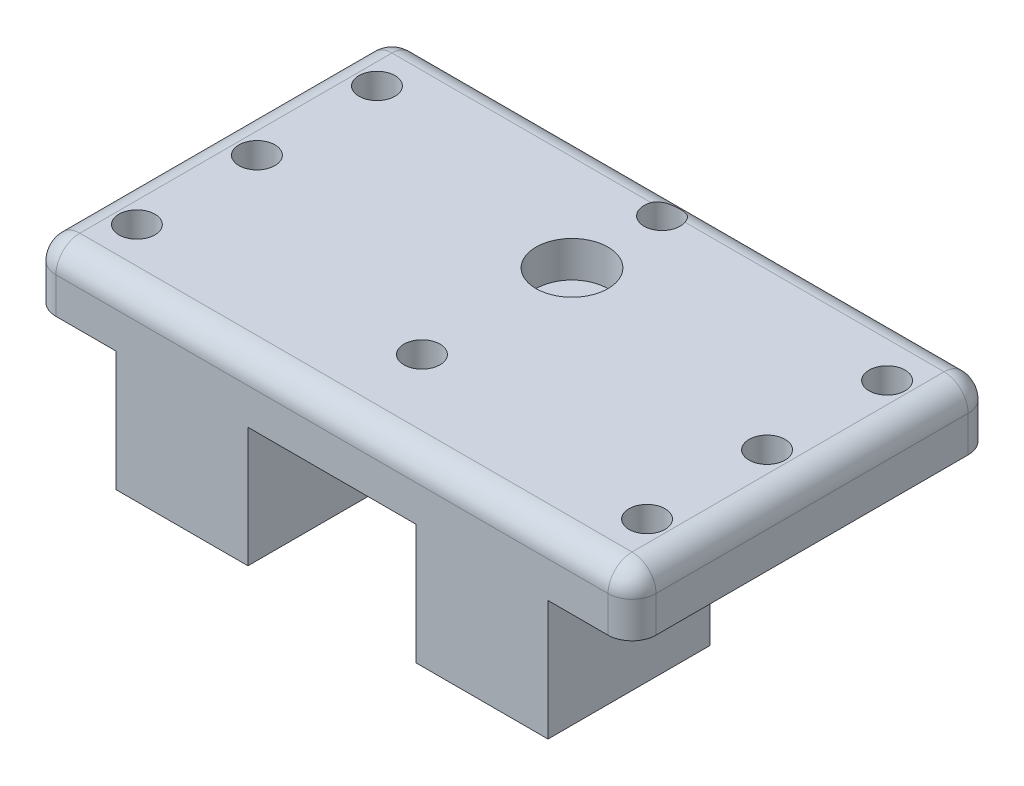
from build123d import *

# Parameters (mm, degrees)
SKETCH_1_W          = 50
SKETCH_1_H          = 30
EXTRUDE_1_DEPTH     = 5
SKETCH_2_R          = 1.25
CUT_EXTRUDE_1_DEPTH = 30.580398915
SKETCH_3_R          = 1.5
CUT_EXTRUDE_2_DEPTH = 30.580398915
SKETCH_4_W          = 11
SKETCH_4_H          = 13.5
EXTRUDE_2_DEPTH     = 10
SKETCH_5_R          = 1.5
CUT_EXTRUDE_3_DEPTH = 33.787192622
FILLET_1_R          = 2
SKETCH_6_R          = 3
CUT_EXTRUDE_4_DEPTH = 3


with BuildPart() as part:
    # Эскиз1 → Бобышка-Вытянуть1 (new body)
    with BuildSketch(Plane(origin=(0, 0, 0), x_dir=(1, 0, 0), z_dir=(0, 1, 0))):
        Rectangle(SKETCH_1_W, SKETCH_1_H)
    extrude(amount=EXTRUDE_1_DEPTH)

    # Эскиз2 → Вырез-Вытянуть1 (cut, through all)
    with BuildSketch(Plane(origin=(0, 5, 0), x_dir=(1, 0, 0), z_dir=(0, 1, 0))):
        with Locations(Location((0, 5, 0), (0, 0, 270))):
            Circle(SKETCH_2_R)
    extrude(amount=-CUT_EXTRUDE_1_DEPTH, mode=Mode.SUBTRACT)

    # Эскиз3 → Вырез-Вытянуть2 (cut, through all)
    with BuildSketch(Plane.XZ):
        with Locations(Location((-21.25, 0, 0), (0, 0, 270))):
            Circle(SKETCH_3_R)
        with Locations(Location((0, 7.5, 0), (0, 0, 270))):
            Circle(SKETCH_3_R)
        with Locations(Location((21.25, 0, 0), (0, 0, 270))):
            Circle(SKETCH_3_R)
        with Locations(Location((0, -12.5, 0), (0, 0, 270))):
            Circle(SKETCH_3_R)
    extrude(amount=-CUT_EXTRUDE_2_DEPTH, mode=Mode.SUBTRACT)

    # Эскиз4 → Бобышка-Вытянуть2 (add)
    with BuildSketch(Plane.XZ):
        with Locations((-12.5, 8.25)):
            Rectangle(SKETCH_4_W, SKETCH_4_H)
        with Locations((12.5, 8.25)):
            Rectangle(SKETCH_4_W, SKETCH_4_H)
    extrude(amount=EXTRUDE_2_DEPTH)

    # Эскиз5 → Вырез-Вытянуть3 (cut, through all)
    with BuildSketch(Plane(origin=(0, 5, 0), x_dir=(1, 0, 0), z_dir=(0, 1, 0))):
        with Locations(Location((-21.25, -10, 0), (0, 0, 270))):
            Circle(SKETCH_5_R)
        with Locations(Location((-21.25, 10, 0), (0, 0, 270))):
            Circle(SKETCH_5_R)
        with Locations(Location((21.25, -10, 0), (0, 0, 270))):
            Circle(SKETCH_5_R)
        with Locations(Location((21.25, 10, 0), (0, 0, 270))):
            Circle(SKETCH_5_R)
    extrude(amount=-CUT_EXTRUDE_3_DEPTH, mode=Mode.SUBTRACT)

    # Скругление1
    # the kernel refuses this fillet: 2 mm, written as the material it takes off along each edge
    with BuildSketch(Plane(origin=(23, 3, -13), x_dir=(0, 1, 0), z_dir=(1, 0, 0))) as fillet_1_piece_1_section:
        Polygon((0, 0), (FILLET_1_R, 0), (FILLET_1_R, -FILLET_1_R), (0, -FILLET_1_R), align=None)
    fillet_1_piece_1 = extrude(amount=FILLET_1_R, mode=Mode.PRIVATE)
    fillet_1_piece_1 = fillet_1_piece_1 - Plane(origin=(23, 3, -13), x_dir=(0, -0.7071067811865475, 0.7071067811865475), z_dir=(1, 0, 0)) * Sphere(FILLET_1_R, mode=Mode.PRIVATE)
    add(fillet_1_piece_1, mode=Mode.SUBTRACT)
    with BuildSketch(Plane(origin=(23, 3, 13), x_dir=(1, 0, 0), z_dir=(0, 0, 1))) as fillet_1_piece_2_section:
        Polygon((0, 0), (FILLET_1_R, 0), (FILLET_1_R, FILLET_1_R), (0, FILLET_1_R), align=None)
    fillet_1_piece_2 = extrude(amount=FILLET_1_R, mode=Mode.PRIVATE)
    fillet_1_piece_2 = fillet_1_piece_2 - Plane(origin=(23, 3, 13), x_dir=(-0.7071067811865475, -0.7071067811865475, 0), z_dir=(0, 0, 1)) * Sphere(FILLET_1_R, mode=Mode.PRIVATE)
    add(fillet_1_piece_2, mode=Mode.SUBTRACT)
    with BuildSketch(Plane(origin=(-23, 3, -13), x_dir=(0, 1, 0), z_dir=(-1, 0, 0))) as fillet_1_piece_3_section:
        Polygon((0, 0), (FILLET_1_R, 0), (FILLET_1_R, FILLET_1_R), (0, FILLET_1_R), align=None)
    fillet_1_piece_3 = extrude(amount=FILLET_1_R, mode=Mode.PRIVATE)
    fillet_1_piece_3 = fillet_1_piece_3 - Plane(origin=(-23, 3, -13), x_dir=(0, -0.7071067811865475, 0.7071067811865475), z_dir=(-1, 0, 0)) * Sphere(FILLET_1_R, mode=Mode.PRIVATE)
    add(fillet_1_piece_3, mode=Mode.SUBTRACT)
    with BuildSketch(Plane(origin=(-23, 3, 13), x_dir=(0, 1, 0), z_dir=(0, 0, 1))) as fillet_1_piece_4_section:
        Polygon((0, 0), (FILLET_1_R, 0), (FILLET_1_R, FILLET_1_R), (0, FILLET_1_R), align=None)
    fillet_1_piece_4 = extrude(amount=FILLET_1_R, mode=Mode.PRIVATE)
    fillet_1_piece_4 = fillet_1_piece_4 - Plane(origin=(-23, 3, 13), x_dir=(0.7071067811865475, -0.7071067811865475, 0), z_dir=(0, 0, 1)) * Sphere(FILLET_1_R, mode=Mode.PRIVATE)
    add(fillet_1_piece_4, mode=Mode.SUBTRACT)
    with BuildSketch(Plane(origin=(25, 5, -13), x_dir=(0, -1, 0), z_dir=(0, 0, 1))) as fillet_1_piece_5:
        with BuildLine():
            CenterArc((FILLET_1_R, -FILLET_1_R), FILLET_1_R, 90, 90)
            Line((0, -FILLET_1_R), (0, 0))
            Line((0, 0), (FILLET_1_R, 0))
        make_face()
    extrude(amount=26, mode=Mode.SUBTRACT)
    with BuildSketch(Plane(origin=(-23, 5, -15), x_dir=(0, 0, 1), z_dir=(1, 0, 0))) as fillet_1_piece_6:
        with BuildLine():
            CenterArc((FILLET_1_R, FILLET_1_R), FILLET_1_R, 180, 90)
            Line((0, FILLET_1_R), (0, 0))
            Line((0, 0), (FILLET_1_R, 0))
        make_face()
    extrude(amount=46, mode=Mode.SUBTRACT)
    with BuildSketch(Plane(origin=(-25, 5, 13), x_dir=(1, 0, 0), z_dir=(0, 0, -1))) as fillet_1_piece_7:
        with BuildLine():
            CenterArc((FILLET_1_R, FILLET_1_R), FILLET_1_R, 180, 90)
            Line((0, FILLET_1_R), (0, 0))
            Line((0, 0), (FILLET_1_R, 0))
        make_face()
    extrude(amount=26, mode=Mode.SUBTRACT)
    with BuildSketch(Plane(origin=(-25, -5, -15), x_dir=(0, 0, 1), z_dir=(0, 1, 0)), Plane(origin=(-25, -5, 15), x_dir=(1, 0, 0), z_dir=(0, 1, 0))) as fillet_1_piece_8:
        with BuildLine():
            CenterArc((FILLET_1_R, FILLET_1_R), FILLET_1_R, 180, 90)
            Line((0, FILLET_1_R), (0, 0))
            Line((0, 0), (FILLET_1_R, 0))
        make_face()
    extrude(amount=8, mode=Mode.SUBTRACT)
    with BuildSketch(Plane(origin=(25, -5, -15), x_dir=(0, 0, 1), z_dir=(0, 1, 0)), Plane(origin=(25, -5, 15), x_dir=(-1, 0, 0), z_dir=(0, 1, 0))) as fillet_1_piece_9:
        with BuildLine():
            CenterArc((FILLET_1_R, -FILLET_1_R), FILLET_1_R, 90, 90)
            Line((0, -FILLET_1_R), (0, 0))
            Line((0, 0), (FILLET_1_R, 0))
        make_face()
    extrude(amount=8, mode=Mode.SUBTRACT)
    with BuildSketch(Plane(origin=(23, 5, 15), x_dir=(0, -1, 0), z_dir=(-1, 0, 0))) as fillet_1_piece_10:
        with BuildLine():
            CenterArc((FILLET_1_R, -FILLET_1_R), FILLET_1_R, 90, 90)
            Line((0, -FILLET_1_R), (0, 0))
            Line((0, 0), (FILLET_1_R, 0))
        make_face()
    extrude(amount=46, mode=Mode.SUBTRACT)

    # Эскиз6 → Вырез-Вытянуть4 (cut)
    with BuildSketch(Plane(origin=(0, 5, 0), x_dir=(1, 0, 0), z_dir=(0, 1, 0))):
        with Locations(Location((0, 5, 0), (0, 0, 270))):
            Circle(SKETCH_6_R)
    extrude(amount=-CUT_EXTRUDE_4_DEPTH, mode=Mode.SUBTRACT)


solid = part.part
